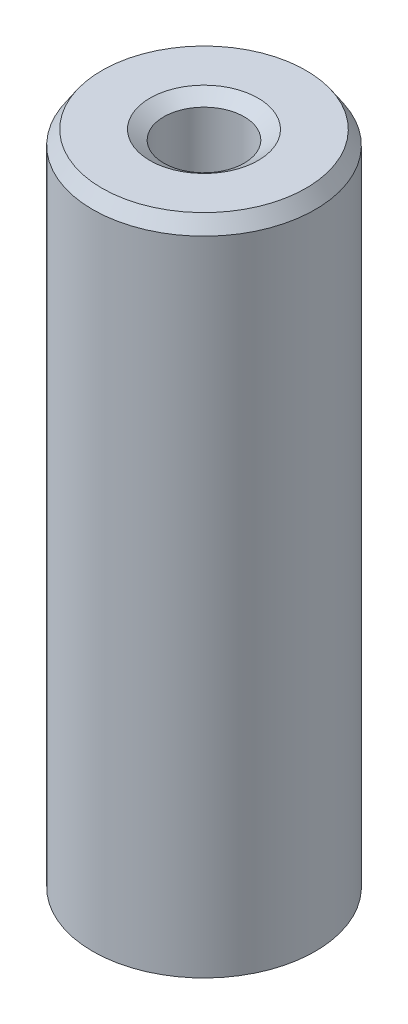
from build123d import *
from OCP.BRepFilletAPI import BRepFilletAPI_MakeChamfer

# Parameters (mm, degrees)
SKETCH1_R           = 5
BOSS_EXTRUDE1_DEPTH = 29.905853832
SKETCH2_R           = 1.8069763
CUT_EXTRUDE1_DEPTH  = 31.730442454
CHAMFER1_SIZE       = 0.624401552
CHAMFER1_SIZE2      = 0.414501486


with BuildPart() as part:
    # Sketch1 → Boss-Extrude1 (new body)
    with BuildSketch(Plane(origin=(0, 0, 0), x_dir=(1, 0, 0), z_dir=(0, 1, 0))):
        Circle(SKETCH1_R)
    extrude(amount=BOSS_EXTRUDE1_DEPTH)

    # Sketch2 → Cut-Extrude1 (cut, through all)
    with BuildSketch(Plane(origin=(0, 0, 0), x_dir=(1, 0, 0), z_dir=(0, 1, 0))):
        Circle(SKETCH2_R)
    extrude(amount=CUT_EXTRUDE1_DEPTH, mode=Mode.SUBTRACT)

    # Chamfer1: one chamfer whose edges measure the first distance from different faces: ONE call of the kernel's chamfer builder (chamfer() names one face for all edges)
    chamfer1_edges_1 = [part.edges().sort_by_distance(p)[0] for p in [
        (-1.8069763, 29.905853832, 0),
    ]]
    chamfer1_side_1 = [part.faces().sort_by_distance(p)[0] for p in [
        (-4.858578644, 29.905853832, 0),
    ]]
    chamfer1_edges_2 = [part.edges().sort_by_distance(p)[0] for p in [
        (-1.8069763, 0, 0),
    ]]
    chamfer1_side_2 = [part.faces().sort_by_distance(p)[0] for p in [
        (-1.8069763, 14.952926916, 0),
    ]]
    chamfer1_edges_3 = [part.edges().sort_by_distance(p)[0] for p in [
        (-5, 0, 0),
    ]]
    chamfer1_side_3 = [part.faces().sort_by_distance(p)[0] for p in [
        (-4.858578644, 0, 0),
    ]]
    chamfer1_edges_4 = [part.edges().sort_by_distance(p)[0] for p in [
        (-5, 29.905853832, 0),
    ]]
    chamfer1_side_4 = [part.faces().sort_by_distance(p)[0] for p in [
        (-5, 14.952926916, 0),
    ]]
    chamfer1 = BRepFilletAPI_MakeChamfer(part.part.solid().wrapped)
    for e in chamfer1_edges_1:
        chamfer1.Add(CHAMFER1_SIZE, CHAMFER1_SIZE2, e.wrapped, chamfer1_side_1[0].wrapped)  # the first distance lies on this face
    for e in chamfer1_edges_2:
        chamfer1.Add(CHAMFER1_SIZE, CHAMFER1_SIZE2, e.wrapped, chamfer1_side_2[0].wrapped)  # the first distance lies on this face
    for e in chamfer1_edges_3:
        chamfer1.Add(CHAMFER1_SIZE, CHAMFER1_SIZE2, e.wrapped, chamfer1_side_3[0].wrapped)  # the first distance lies on this face
    for e in chamfer1_edges_4:
        chamfer1.Add(CHAMFER1_SIZE, CHAMFER1_SIZE2, e.wrapped, chamfer1_side_4[0].wrapped)  # the first distance lies on this face
    add(Compound.cast(chamfer1.Shape()), mode=Mode.REPLACE)


solid = part.part
